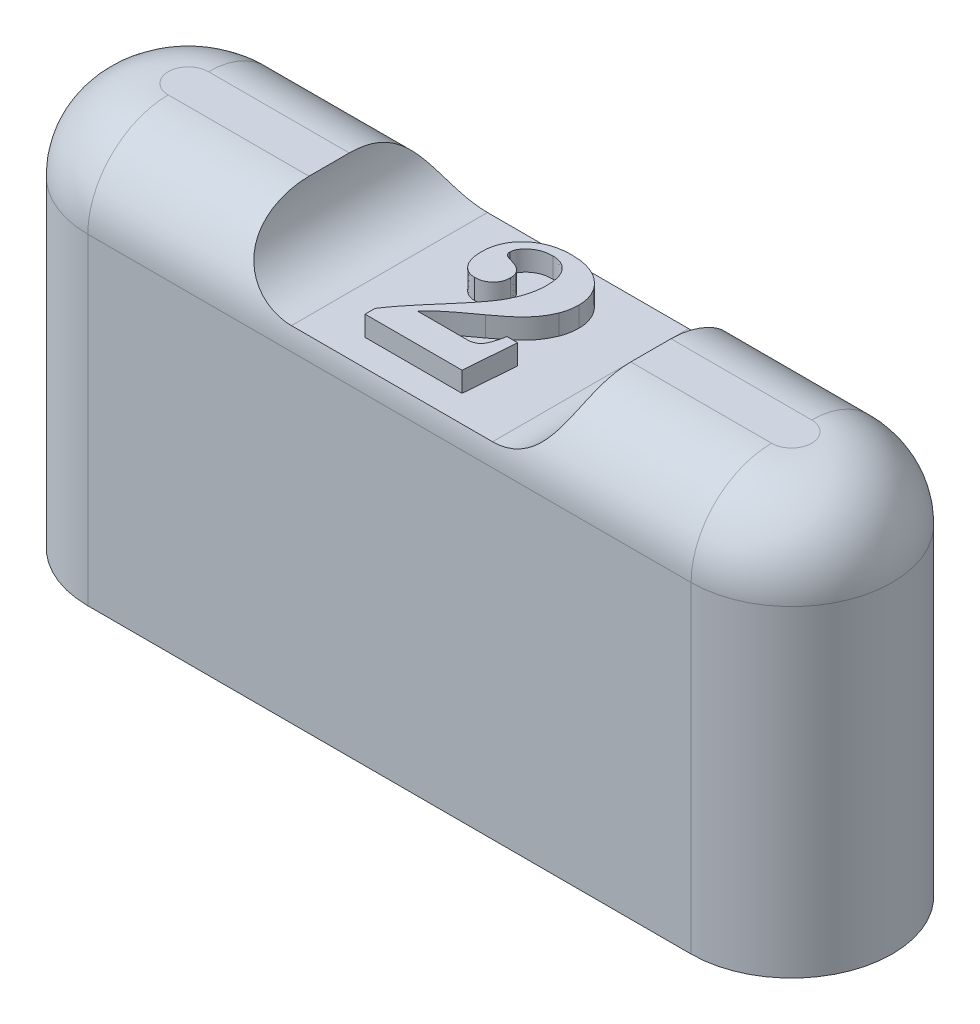
from build123d import *

# Parameters (mm, degrees)
BOSS_EXTRUDE1_DEPTH     = 20
FILLET1_R               = 4
SKETCH2_R               = 2.75
CUT_EXTRUDE1_DEPTH      = 1.5
LPATTERN1_COUNT         = 2
LPATTERN1_PITCH         = 30
CUT_EXTRUDE2_DEPTH      = 29.722813233
CUT_EXTRUDE2_DEPTH_BACK = 29.722813233
WRAP1_DEPTH             = 1


# Read off the part's stored shape, not the designer's step: Wrap1
with BuildPart() as part:
    # Sketch1 → Boss-Extrude1 (new body)
    with BuildSketch(Plane(origin=(0, 0, 0), x_dir=(1, 0, 0), z_dir=(0, 1, 0))):
        with BuildLine():
            Line((15, -5), (-15, -5))
            ThreePointArc((-15, -5), (-20, 0), (-15, 5))
            Line((-15, 5), (15, 5))
            ThreePointArc((15, 5), (20, 0), (15, -5))
        make_face()
    extrude(amount=BOSS_EXTRUDE1_DEPTH)

    # Fillet1
    fillet1_edges = [part.edges().sort_by_distance(p)[0] for p in [
        (-20, 20, 0),
        (0, 20, 5),
        (20, 20, 0),
        (0, 20, -5),
    ]]
    fillet(fillet1_edges, radius=FILLET1_R)

    # Sketch2 → Cut-Extrude1 (cut)
    with BuildSketch(Plane.XZ):
        with Locations(Location((-15, 0, 0), (0, 0, 270))):
            Circle(SKETCH2_R)
    cut_extrude1 = extrude(amount=-CUT_EXTRUDE1_DEPTH, mode=Mode.SUBTRACT)

    # LPattern1: Cut-Extrude1 ×2
    with Locations(*[(i * LPATTERN1_PITCH, 0, 0) for i in range(1, LPATTERN1_COUNT)]):
        add(cut_extrude1, mode=Mode.SUBTRACT)

    # Sketch3 → Cut-Extrude2 (cut, two sides: drawn at the far end of the back side and taken through both)
    with BuildSketch(Plane.XY.offset(-CUT_EXTRUDE2_DEPTH_BACK)):
        with BuildLine():
            Line((-5, 23), (5, 23))
            ThreePointArc((5, 23), (8, 20), (5, 17))
            Line((5, 17), (-5, 17))
            ThreePointArc((-5, 17), (-8, 20), (-5, 23))
        make_face()
    extrude(amount=CUT_EXTRUDE2_DEPTH + CUT_EXTRUDE2_DEPTH_BACK, mode=Mode.SUBTRACT)

    # Wrap1 outline → Wrap1 (add)
    with BuildSketch(Plane(origin=(0, 17, 0), x_dir=(1, 0, 0), z_dir=(0, 1, 0))):
        with BuildLine():
            add(Edge.make_bspline(
                [(0.968558604, -2.112404227), (1.023340463, -2.110381468), (1.128135866, -2.106512015), (1.275421614, -2.065066433), (1.40411806, -1.999153831), (1.494113345, -1.918796765), (1.555259283, -1.8377784), (1.600182088, -1.761379971), (1.643056037, -1.669468115), (1.68410688, -1.562162987), (1.724115658, -1.439672484), (1.762787282, -1.301883834), (1.796828359, -1.147944523), (1.819117415, -1.040313742), (1.830738091, -0.984199098)],
                knots=[0, 0, 0, 0, 0.10403341, 0.199011557, 0.288612319, 0.377191825, 0.425797175, 0.481425289, 0.545557079, 0.61863331, 0.699984683, 0.790771883, 0.890916323, 1, 1, 1, 1], degree=3))
            Line((0.968558604, -2.112404227), (-1.502595242, -2.112404227))
            add(Edge.make_bspline(
                [(0.359584245, -0.57875038), (0.287589412, -0.631266446), (0.149119993, -0.732271876), (-0.052040125, -0.874957595), (-0.232151558, -1.010570949), (-0.396984875, -1.13231455), (-0.543079134, -1.243803459), (-0.672030163, -1.343433338), (-0.782764208, -1.43141572), (-0.961872458, -1.579798827), (-1.207220157, -1.798528227), (-1.40469562, -2.00837263), (-1.502595242, -2.112404227)],
                knots=[0, 0, 0, 0, 0.110593572, 0.212707314, 0.306051588, 0.390379305, 0.467018215, 0.534117187, 0.592614819, 0.642525788, 0.822780058, 1, 1, 1, 1], degree=3))
            add(Edge.make_bspline(
                [(2.103173989, 1.329903466), (2.066781163, 1.246346618), (1.99482956, 1.081147874), (1.86047631, 0.847661593), (1.71297016, 0.626020413), (1.571074283, 0.452909604), (1.445054335, 0.315568643), (1.334068385, 0.207346612), (1.208958187, 0.091994137), (1.069166496, -0.030104), (0.913592831, -0.158279882), (0.741560734, -0.29208501), (0.556771712, -0.435146764), (0.42660857, -0.529939289), (0.359584245, -0.57875038)],
                knots=[0, 0, 0, 0, 0.10413489, 0.205883221, 0.307528832, 0.408265615, 0.461433854, 0.520606469, 0.585444086, 0.656004792, 0.732803839, 0.815893726, 0.905198979, 1, 1, 1, 1], degree=3))
            add(Edge.make_bspline(
                [(2.258622707, 2.155223979), (2.256854974, 2.081406691), (2.253395008, 1.936924834), (2.223825952, 1.724789841), (2.174767432, 1.522306219), (2.126875674, 1.393600214), (2.103173989, 1.329903466)],
                knots=[0, 0, 0, 0, 0.261979501, 0.512769921, 0.758869279, 1, 1, 1, 1], degree=3))
            add(Edge.make_bspline(
                [(-0.061890114, 4.14400603), (0.022564629, 4.141920306), (0.18812583, 4.13783155), (0.430620451, 4.112847977), (0.660471364, 4.067558501), (0.878305178, 4.005888588), (1.082018473, 3.923000729), (1.274759097, 3.825795699), (1.453280397, 3.707304776), (1.618929442, 3.573545968), (1.768923738, 3.427244365), (1.900049838, 3.270535022), (2.011299511, 3.105351175), (2.101257211, 2.93081783), (2.172841542, 2.749020464), (2.221753805, 2.558426678), (2.253872753, 2.359840276), (2.257020026, 2.224263519), (2.258622707, 2.155223979)],
                knots=[0, 0, 0, 0, 0.074102612, 0.14526736, 0.21355926, 0.279416432, 0.343556942, 0.406228654, 0.468492489, 0.531146675, 0.592790073, 0.652016559, 0.710119813, 0.767135501, 0.823967905, 0.881147087, 0.939476717, 1, 1, 1, 1], degree=3))
            add(Edge.make_bspline(
                [(-1.906441396, 3.445288081), (-1.848306189, 3.501112989), (-1.732554849, 3.612264359), (-1.538609793, 3.754854821), (-1.330466242, 3.876473687), (-1.105791254, 3.973994027), (-0.866480346, 4.051164268), (-0.611446439, 4.105367467), (-0.341562002, 4.137488539), (-0.156530269, 4.14180053), (-0.061890114, 4.14400603)],
                knots=[0, 0, 0, 0, 0.119107626, 0.23715177, 0.355050392, 0.47498588, 0.598670295, 0.726365388, 0.860041186, 1, 1, 1, 1], degree=3))
            add(Edge.make_bspline(
                [(-2.459326011, 2.031826543), (-2.458122329, 2.10083777), (-2.455751672, 2.236755643), (-2.42704922, 2.435648535), (-2.383831572, 2.625974396), (-2.325084873, 2.808678323), (-2.245799792, 2.981581962), (-2.150493697, 3.146407777), (-2.038697096, 3.303051555), (-1.950794522, 3.397587797), (-1.906441396, 3.445288081)],
                knots=[0, 0, 0, 0, 0.132803649, 0.26155729, 0.386082589, 0.508400008, 0.630401232, 0.751619273, 0.874674186, 1, 1, 1, 1], degree=3))
            add(Edge.make_bspline(
                [(-1.520223447, 0.759390645), (-1.585420599, 0.763118791), (-1.713143024, 0.770422298), (-1.895082142, 0.836934937), (-2.058691576, 0.943915448), (-2.201841078, 1.092044894), (-2.320121913, 1.277705611), (-2.399559254, 1.501224402), (-2.452612405, 1.75530448), (-2.457009968, 1.936432658), (-2.459326011, 2.031826543)],
                knots=[0, 0, 0, 0, 0.110139331, 0.215764983, 0.323707128, 0.438906263, 0.562183724, 0.693638164, 0.838649921, 1, 1, 1, 1], degree=3))
            add(Edge.make_bspline(
                [(-0.613172165, 1.631185517), (-0.616054345, 1.570486701), (-0.621662157, 1.45238594), (-0.671323685, 1.283175242), (-0.754629801, 1.131365188), (-0.869218028, 1.000302814), (-1.00648217, 0.893380798), (-1.162575656, 0.81342959), (-1.336719307, 0.768952542), (-1.458017598, 0.762632021), (-1.520223447, 0.759390645)],
                knots=[0, 0, 0, 0, 0.129242333, 0.251464839, 0.372304265, 0.495878621, 0.620081591, 0.741344555, 0.867352775, 1, 1, 1, 1], degree=3))
            add(Edge.make_bspline(
                [(-1.273428575, 2.371570132), (-1.221111857, 2.356431424), (-1.121681232, 2.327659528), (-0.986315759, 2.264054818), (-0.872118751, 2.188748181), (-0.775565412, 2.103031066), (-0.702763657, 2.001965174), (-0.650977929, 1.888692008), (-0.61737495, 1.763975364), (-0.614599413, 1.676280399), (-0.613172165, 1.631185517)],
                knots=[0, 0, 0, 0, 0.151156851, 0.287281401, 0.413669873, 0.530293514, 0.644009236, 0.756908248, 0.874996313, 1, 1, 1, 1], degree=3))
            add(Edge.make_bspline(
                [(-1.659646524, 2.52701885), (-1.641908981, 2.5134804), (-1.599762076, 2.48131113), (-1.513799429, 2.446453071), (-1.403911325, 2.405291879), (-1.319666952, 2.383519902), (-1.273428575, 2.371570132)],
                knots=[0, 0, 0, 0, 0.159109439, 0.378066483, 0.65864549, 1, 1, 1, 1], degree=3))
            add(Edge.make_bspline(
                [(-1.741377293, 2.725736799), (-1.740702967, 2.705828636), (-1.739402264, 2.667427893), (-1.722346439, 2.613602242), (-1.696843256, 2.565494988), (-1.672067897, 2.539867464), (-1.659646524, 2.52701885)],
                knots=[0, 0, 0, 0, 0.268945253, 0.518766978, 0.758729042, 1, 1, 1, 1], degree=3))
            add(Edge.make_bspline(
                [(-0.509005498, 3.631185517), (-0.593702292, 3.627478268), (-0.757485819, 3.620309328), (-0.992510379, 3.565399378), (-1.204920463, 3.4708981), (-1.388970755, 3.342097951), (-1.54050767, 3.195942921), (-1.655393233, 3.044422755), (-1.727025811, 2.886507887), (-1.736695124, 2.778188345), (-1.741377293, 2.725736799)],
                knots=[0, 0, 0, 0, 0.151816317, 0.293576777, 0.429964406, 0.566304914, 0.694365033, 0.806085808, 0.906100976, 1, 1, 1, 1], degree=3))
            add(Edge.make_bspline(
                [(0.617597066, 2.220929107), (0.616798314, 2.277062503), (0.615251229, 2.385786079), (0.599863671, 2.542997259), (0.579004071, 2.690242583), (0.544058374, 2.826348498), (0.504153512, 2.954009696), (0.449772713, 3.069509609), (0.389899195, 3.176431124), (0.318093883, 3.271087373), (0.240513737, 3.356936451), (0.152380296, 3.428872442), (0.059506725, 3.491963217), (-0.040243661, 3.543993611), (-0.147906764, 3.581901434), (-0.261368703, 3.611540097), (-0.38306343, 3.626855058), (-0.466235221, 3.629714881), (-0.509005498, 3.631185517)],
                knots=[0, 0, 0, 0, 0.082284271, 0.159374645, 0.231497254, 0.300083139, 0.36523236, 0.427274673, 0.486932074, 0.544586116, 0.60112786, 0.656190593, 0.710940404, 0.765594865, 0.820607428, 0.877984079, 0.93725451, 1, 1, 1, 1], degree=3))
            add(Edge.make_bspline(
                [(0.205738091, 0.635993209), (0.238640814, 0.700768661), (0.303861654, 0.829168655), (0.385865127, 1.026897746), (0.459663901, 1.22391557), (0.516579645, 1.422967903), (0.561905142, 1.621957205), (0.593823909, 1.82108009), (0.613938148, 2.020726724), (0.616375849, 2.154108657), (0.617597066, 2.220929107)],
                knots=[0, 0, 0, 0, 0.131745637, 0.261150462, 0.388067803, 0.513189353, 0.636374668, 0.758087597, 0.878808958, 1, 1, 1, 1], degree=3))
            add(Edge.make_bspline(
                [(-1.116377293, -1.107596534), (-1.03496234, -1.013767374), (-0.878016077, -0.832889839), (-0.655626445, -0.569536189), (-0.456135085, -0.32390871), (-0.280159151, -0.096566641), (-0.125247461, 0.111659158), (0.00577288, 0.302221735), (0.116680709, 0.473318508), (0.177475044, 0.584367138), (0.205738091, 0.635993209)],
                knots=[0, 0, 0, 0, 0.170005554, 0.327725258, 0.471696803, 0.603008639, 0.721148947, 0.826797124, 0.919478664, 1, 1, 1, 1], degree=3))
            add(Edge.make_bspline(
                [(-2.664454216, -3.057917047), (-2.628698989, -3.000910883), (-2.55158858, -2.877970296), (-2.41479269, -2.688825323), (-2.259314405, -2.474715573), (-2.074551732, -2.243606397), (-1.870318919, -1.988170585), (-1.640593125, -1.712928149), (-1.387471618, -1.416348269), (-1.20904993, -1.213142224), (-1.116377293, -1.107596534)],
                knots=[0, 0, 0, 0, 0.080973991, 0.174630064, 0.280853316, 0.39944862, 0.530692677, 0.674513651, 0.830941638, 1, 1, 1, 1], degree=3))
            Line((-2.664454216, -3.057917047), (-2.664454216, -3.548301662))
            Line((-2.664454216, -3.548301662), (2.156058604, -3.548301662))
            Line((2.156058604, -3.548301662), (2.361186809, -0.984199098))
            Line((2.361186809, -0.984199098), (1.830738091, -0.984199098))
        make_face()
    extrude(amount=WRAP1_DEPTH)


solid = part.part
